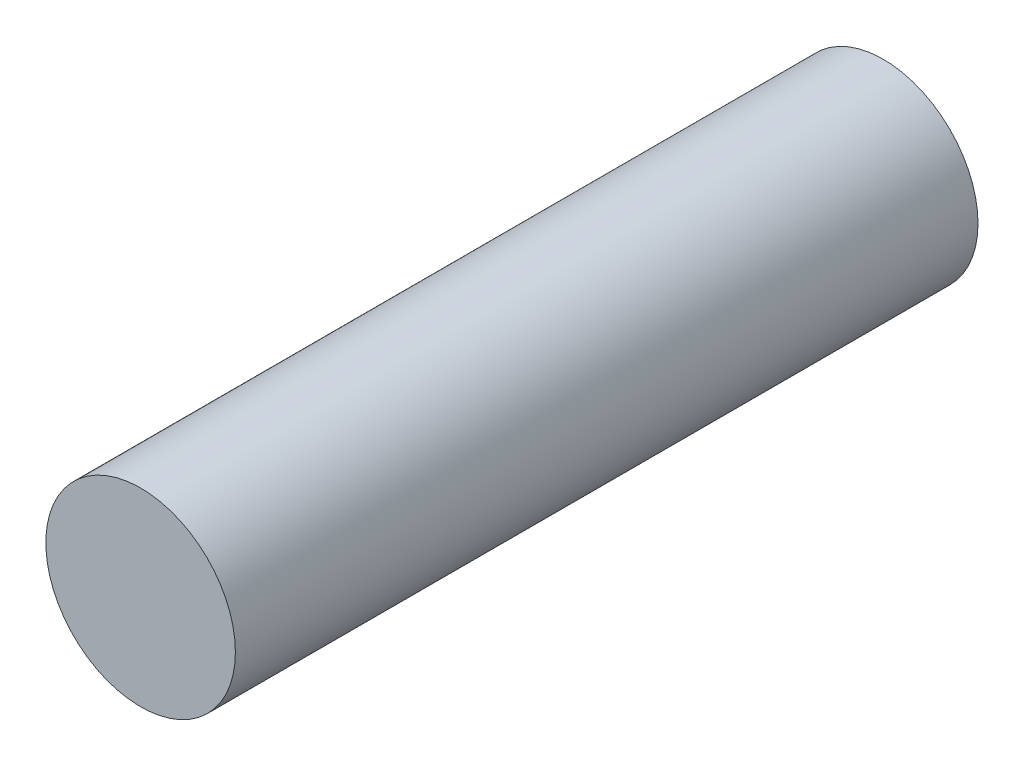
from build123d import *

# Parameters (mm, degrees)
SKETCH1_R           = 2.5
BOSS_EXTRUDE1_DEPTH = 19.59


with BuildPart() as part:
    # Sketch1 → Boss-Extrude1 (new body)
    with BuildSketch(Plane.XY):
        Circle(SKETCH1_R)
    extrude(amount=BOSS_EXTRUDE1_DEPTH)


solid = part.part
